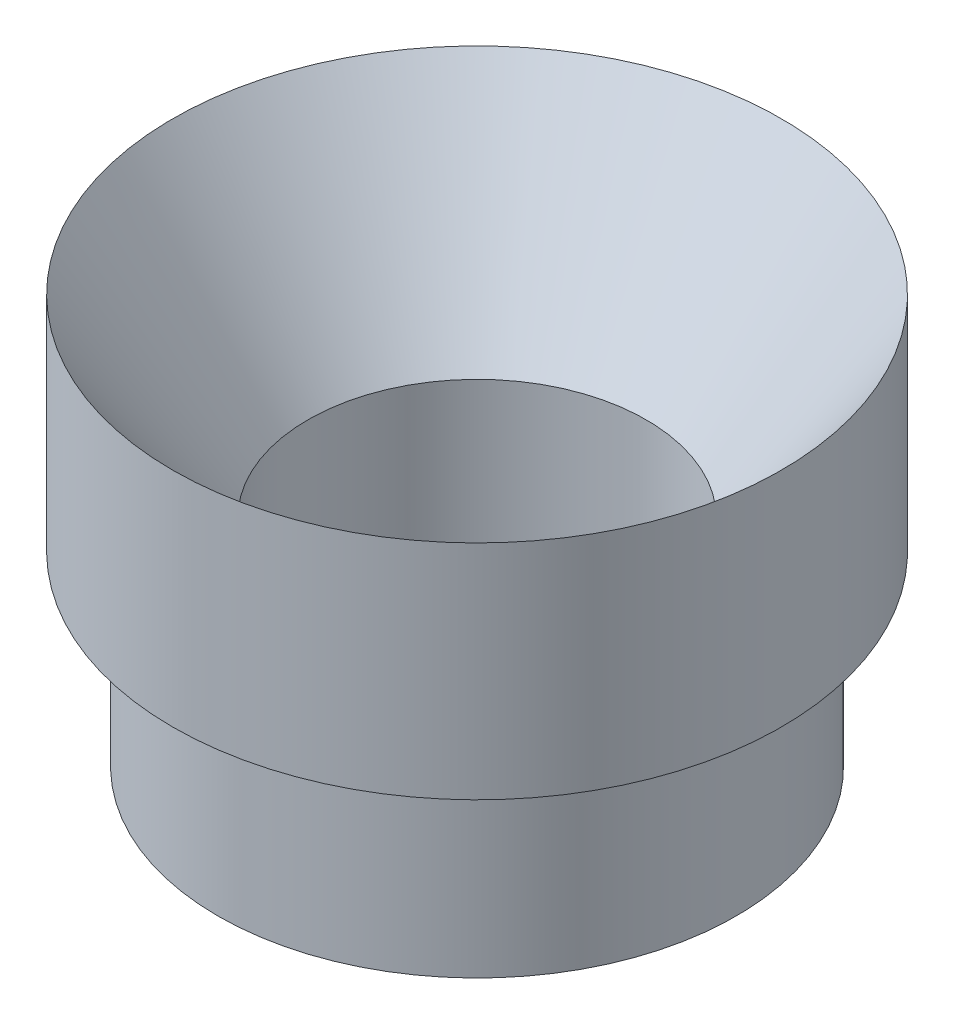
from build123d import *


with BuildPart() as part:
    # Sketch4 → Revolve1 (revolve)
    with BuildSketch(Plane(origin=(0, 0, 0), x_dir=(0, 0, -1), z_dir=(1, 0, 0))):
        Polygon((34.2773, 0), (19.05, -21.746838143), (19.05, -38.149257502), (20.382233443, -46.030856842), (29.1846, -46.030856842), (29.1846, -25.050456842), (34.2773, -25.050456842), align=None)
    revolve(axis=Axis((0, 0, 0), (0, -1, 0)))


solid = part.part
